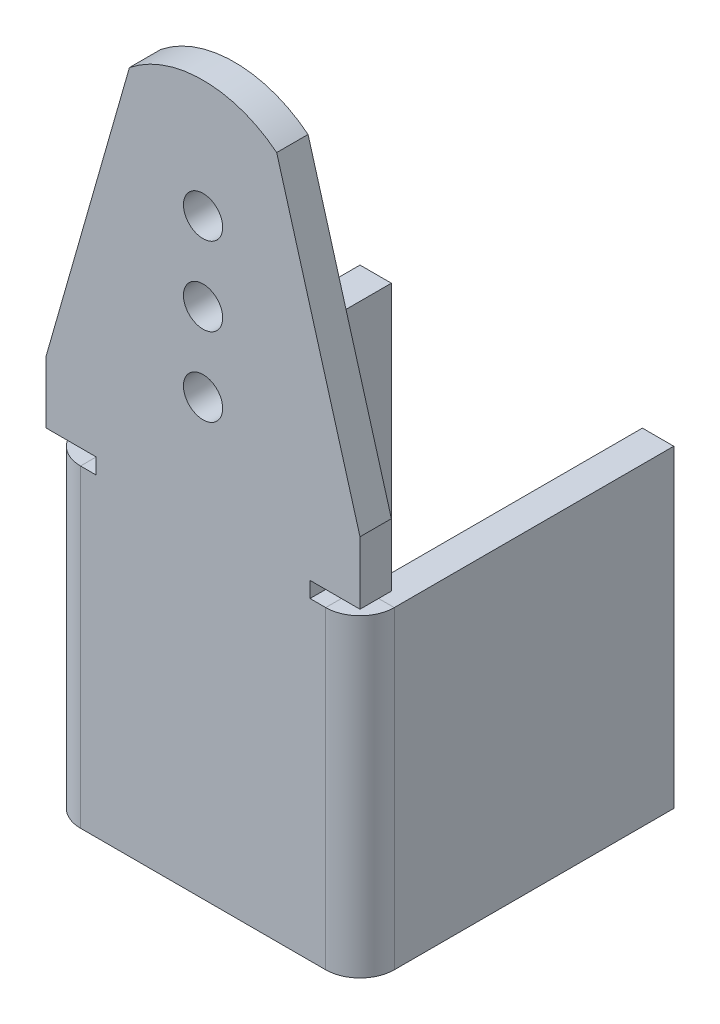
from build123d import *

# Parameters (mm, degrees)
SKETCH_1_R                         = 5
SM_BASE_FLANGE_2_DEPTH             = 8
SM_EDGE_FLANGE_10_STRIP_W          = 33.4732
SM_EDGE_FLANGE_10_STRIP_H          = 8
SM_EDGE_FLANGE_10_STRIP_CUT_DEPTH  = 80
SM_EDGE_FLANGE_10_RELIEF_W         = 37.4732
SM_EDGE_FLANGE_10_RELIEF_H         = 4
SM_EDGE_FLANGE_10_RELIEF_CUT_DEPTH = 8
SM_EDGE_FLANGE_10_DEPTH            = 80
SM_EDGE_FLANGE_12_STRIP_W          = 33.4732
SM_EDGE_FLANGE_12_STRIP_H          = 8
SM_EDGE_FLANGE_12_STRIP_CUT_DEPTH  = 80
SM_EDGE_FLANGE_12_RELIEF_W         = 37.4732
SM_EDGE_FLANGE_12_RELIEF_H         = 4
SM_EDGE_FLANGE_12_RELIEF_CUT_DEPTH = 8
SM_EDGE_FLANGE_12_DEPTH            = 80


# Sheet-metal steps are written as plain solids
with BuildPart() as part:
    # 草图1 → 基体-法兰2 (new body)
    with BuildSketch(Plane.XY):
        with BuildLine():
            Line((0, 0), (80, 0))
            Line((80, 0), (80, 100))
            Line((80, 100), (58.758007847, 174.223096705))
            ThreePointArc((58.758007847, 174.223096705), (39.983985428, 180.823607775), (21.209963009, 174.223096705))
            Line((21.209963009, 174.223096705), (0, 100))
            Line((0, 100), (0, 0))
        make_face()
        with Locations((39.983985428, 150.823607775)):
            Circle(SKETCH_1_R, mode=Mode.SUBTRACT)
        with Locations((39.983985428, 130.823607775)):
            Circle(SKETCH_1_R, mode=Mode.SUBTRACT)
        with Locations((39.983985428, 110.823607775)):
            Circle(SKETCH_1_R, mode=Mode.SUBTRACT)
    extrude(amount=-SM_BASE_FLANGE_2_DEPTH)

    # 边线-法兰10 strip (across the edge) → 边线-法兰10 strip cut (cut)
    with BuildSketch(Plane(origin=(80, 80, -8), x_dir=(-1, 0, 0), z_dir=(0, -1, 0))):
        with Locations((-8, -4)):
            Rectangle(SM_EDGE_FLANGE_10_STRIP_W, SM_EDGE_FLANGE_10_STRIP_H)
    extrude(amount=SM_EDGE_FLANGE_10_STRIP_CUT_DEPTH, mode=Mode.SUBTRACT)

    # 边线-法兰10 relief (on the sheet) → 边线-法兰10 relief cut (cut)
    with BuildSketch(Plane(origin=(71.2634, 80, -8), x_dir=(-1, 0, 0), z_dir=(0, 0, -1))):
        with Locations((-14.7366, 2)):
            Rectangle(SM_EDGE_FLANGE_10_RELIEF_W, SM_EDGE_FLANGE_10_RELIEF_H)
    extrude(amount=-SM_EDGE_FLANGE_10_RELIEF_CUT_DEPTH, mode=Mode.SUBTRACT)

    # 边线-法兰10 section (across the edge) → 边线-法兰10 (add)
    with BuildSketch(Plane(origin=(80, 80, -8), x_dir=(-1, 0, 0), z_dir=(0, -1, 0))):
        with BuildLine():
            Line((0, 0.7366), (0, 72))
            Line((0, 72), (8, 72))
            Line((8, 72), (8, 0.7366))
            ThreePointArc((8, 0.7366), (8.215745145, 0.215745145), (8.7366, 0))
            Line((8.7366, 0), (8.7366, -8))
            ThreePointArc((8.7366, -8), (2.558890895, -5.441109105), (0, 0.7366))
        make_face()
    extrude(amount=SM_EDGE_FLANGE_10_DEPTH)

    # 边线-法兰12 strip (across the edge) → 边线-法兰12 strip cut (cut)
    with BuildSketch(Plane(origin=(0, 0, -8), x_dir=(1, 0, 0), z_dir=(0, 1, 0))):
        with Locations((-8, -4)):
            Rectangle(SM_EDGE_FLANGE_12_STRIP_W, SM_EDGE_FLANGE_12_STRIP_H)
    extrude(amount=SM_EDGE_FLANGE_12_STRIP_CUT_DEPTH, mode=Mode.SUBTRACT)

    # 边线-法兰12 relief (on the sheet) → 边线-法兰12 relief cut (cut)
    with BuildSketch(Plane(origin=(8.7366, 0, -8), x_dir=(1, 0, 0), z_dir=(0, 0, -1))):
        with Locations((-14.7366, -82)):
            Rectangle(SM_EDGE_FLANGE_12_RELIEF_W, SM_EDGE_FLANGE_12_RELIEF_H)
    extrude(amount=-SM_EDGE_FLANGE_12_RELIEF_CUT_DEPTH, mode=Mode.SUBTRACT)

    # 边线-法兰12 section (across the edge) → 边线-法兰12 (add)
    with BuildSketch(Plane(origin=(0, 0, -8), x_dir=(1, 0, 0), z_dir=(0, 1, 0))):
        with BuildLine():
            Line((0, 0.7366), (0, 72))
            Line((0, 72), (8, 72))
            Line((8, 72), (8, 0.7366))
            ThreePointArc((8, 0.7366), (8.215745145, 0.215745145), (8.7366, 0))
            Line((8.7366, 0), (8.7366, -8))
            ThreePointArc((8.7366, -8), (2.558890895, -5.441109105), (0, 0.7366))
        make_face()
    extrude(amount=SM_EDGE_FLANGE_12_DEPTH)


solid = part.part
